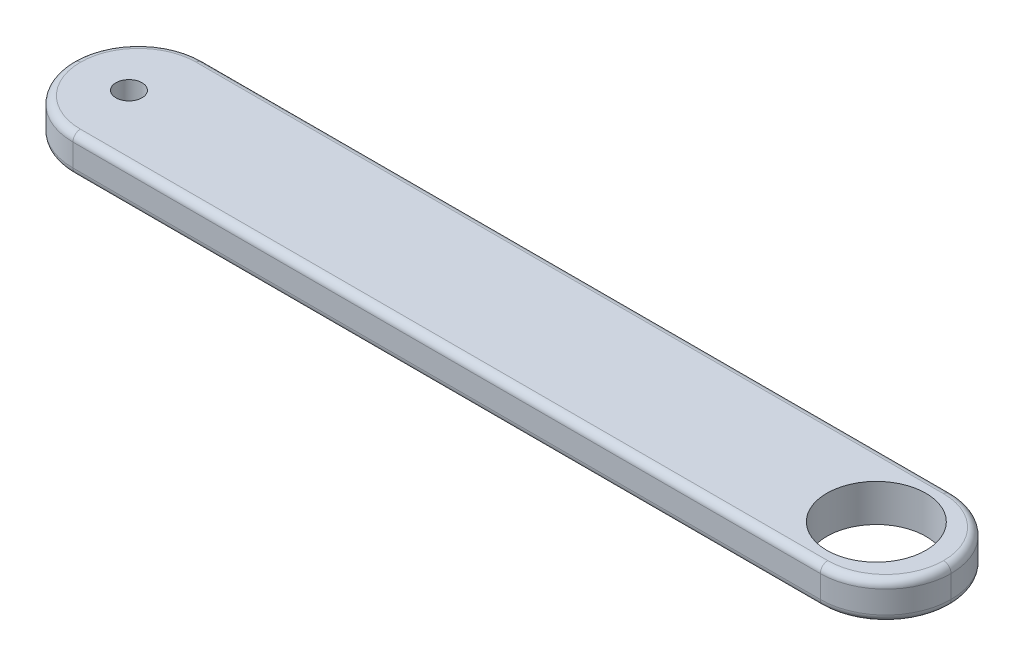
from build123d import *

# Parameters (mm, degrees)
CROQUIS1_W              = 235
CROQUIS1_H              = 35
CROQUIS1_R              = 13.25
CROQUIS1_R_2            = 3.5
SALIENTE_EXTRUIR1_DEPTH = 10
REDONDEO1_R             = 17.5
REDONDEO2_R             = 2


with BuildPart() as part:
    # Croquis1 → Saliente-Extruir1 (new body)
    with BuildSketch(Plane(origin=(0, 0, 0), x_dir=(1, 0, 0), z_dir=(0, 1, 0))):
        with Locations((-117.5, 17.5)):
            Rectangle(CROQUIS1_W, CROQUIS1_H)
        with Locations(Location((-20, 17.5, 0), (0, 0, 270))):
            Circle(CROQUIS1_R, mode=Mode.SUBTRACT)
        with Locations(Location((-220, 17.5, 0), (0, 0, 270))):
            Circle(CROQUIS1_R_2, mode=Mode.SUBTRACT)
    extrude(amount=SALIENTE_EXTRUIR1_DEPTH)

    # Redondeo1
    redondeo1_edges = [part.edges().sort_by_distance(p)[0] for p in [
        (0, 5, 0),
        (0, 5, -35),
        (-235, 5, -35),
        (-235, 5, 0),
    ]]
    fillet(redondeo1_edges, radius=REDONDEO1_R - 0.0001)  # a hair under: the kernel refuses the full size

    # Redondeo2
    redondeo2_edges = [part.edges().sort_by_distance(p)[0] for p in [
        (-117.5, 0, 0),
        (-117.5, 0, -35),
        (-229.87439796, 0, -5.12560204),
        (-229.87439796, 0, -29.87439796),
        (-5.12560204, 0, -29.87439796),
        (-5.12560204, 0, -5.12560204),
        (-117.5, 10, 0),
        (-117.5, 10, -35),
        (-229.87439796, 10, -5.12560204),
        (-229.87439796, 10, -29.87439796),
        (-5.12560204, 10, -29.87439796),
        (-5.12560204, 10, -5.12560204),
    ]]
    fillet(redondeo2_edges, radius=REDONDEO2_R)


solid = part.part
